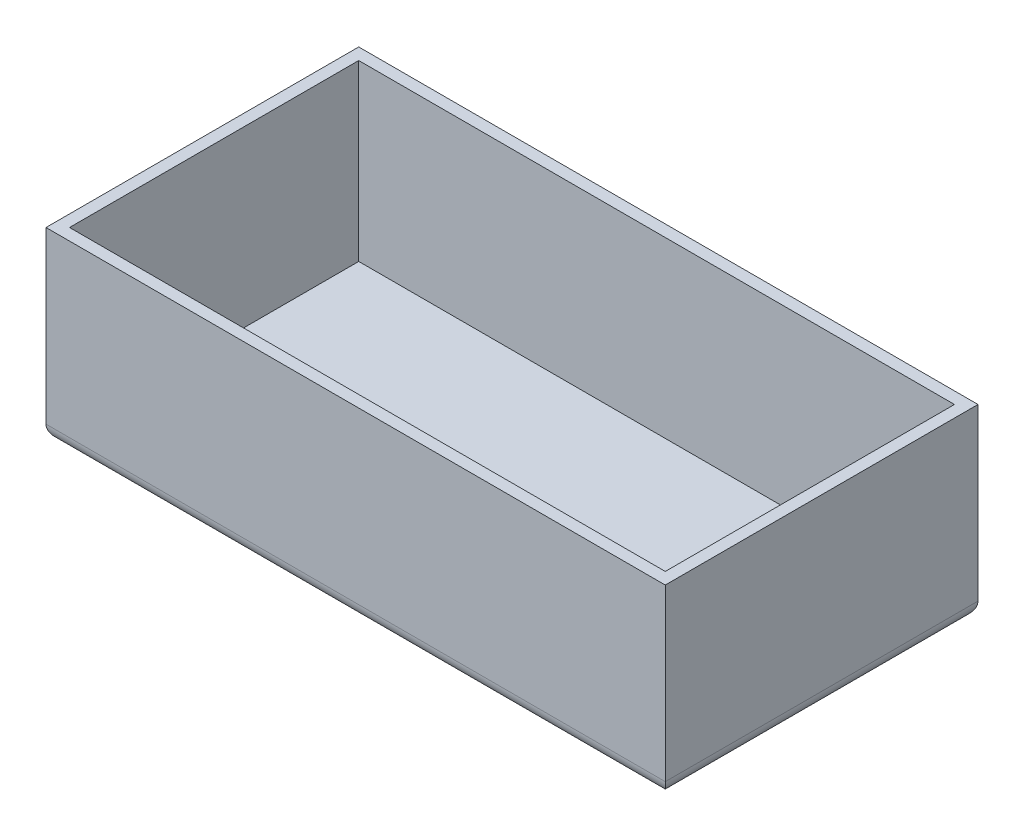
from build123d import *

# Parameters (mm, degrees)
CROQUIS1_W              = 200
CROQUIS1_H              = 101
SALIENTE_EXTRUIR1_DEPTH = 60
VACIADO1_T              = -3.8
REDONDEO3_R             = 5


with BuildPart() as part:
    # Croquis1 → Saliente-Extruir1 (new body)
    with BuildSketch(Plane(origin=(0, 0, 0), x_dir=(1, 0, 0), z_dir=(0, 1, 0))):
        Rectangle(CROQUIS1_W, CROQUIS1_H)
    extrude(amount=SALIENTE_EXTRUIR1_DEPTH)

    # Vaciado1
    vaciado1_openings = [part.faces().sort_by_distance(p)[0] for p in [
        (0, 60, 0),
    ]]
    offset(amount=VACIADO1_T, openings=vaciado1_openings, kind=Kind.INTERSECTION)

    # Redondeo3
    redondeo3_edges = [part.edges().sort_by_distance(p)[0] for p in [
        (-100, 0, 0),
        (0, 0, 50.5),
        (100, 0, 0),
        (0, 0, -50.5),
    ]]
    fillet(redondeo3_edges, radius=REDONDEO3_R)


solid = part.part
